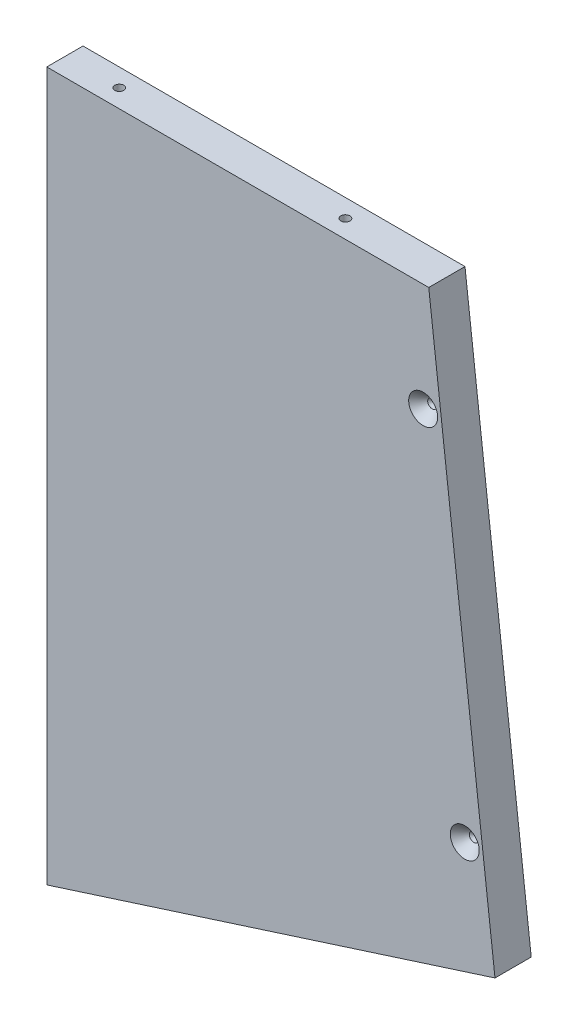
from build123d import *

# Parameters (mm, degrees)
BOSS_EXTRUDE1_DEPTH = 12.7
HOLE3_D             = 3.175
HOLE3_DEPTH         = 31.75
HOLE3_CSINK_D       = 10.16
HOLE3_CSINK_ANGLE   = 82
HOLE3_TIP           = 0.953866233
HOLE6_AT_2_COUNT    = 2
HOLE6_AT_2_PITCH    = 125.108514383
HOLE7_D             = 3.175
HOLE7_DEPTH         = 31.75
HOLE7_CSINK_D       = 10.16
HOLE7_CSINK_ANGLE   = 82
HOLE7_TIP           = 0.953866233
HOLE8_D             = 3.175
HOLE8_DEPTH         = 31.75
HOLE8_CSINK_D       = 10.16
HOLE8_CSINK_ANGLE   = 82
HOLE8_TIP           = 0.953866233


with BuildPart() as part:
    # Sketch1 → Boss-Extrude1 (new body)
    with BuildSketch(Plane.XY):
        Polygon((-88.190159952, 0), (-222.052967181, 0), (-222.052967181, -248.25), (-64.977416983, -197.966048293), align=None)
    extrude(amount=-BOSS_EXTRUDE1_DEPTH)

    # Hole3
    with Locations(Plane(origin=(-234.752967181, 1090.512770337, -135.816741379), x_dir=(0, 0, -1), z_dir=(-1, 0, 0))):
        with Locations((-129.466741379, 1300.662770337), (-129.466741379, 1128.612770337), (129.198788767, 1128.612770337), (129.198788767, 1300.662770337)):
            CounterSinkHole(HOLE3_D / 2, HOLE3_CSINK_D / 2, depth=HOLE3_DEPTH, counter_sink_angle=HOLE3_CSINK_ANGLE)
            with Locations((0, 0, -(HOLE3_DEPTH + HOLE3_TIP / 2))):  # 118° drill point
                Cone(0, HOLE3_D / 2, HOLE3_TIP, mode=Mode.SUBTRACT)

    # Sketch13 → Hole6 (revolve, cut)
    with BuildSketch(Plane(origin=(-90.146601991, -37.840751583, 0), x_dir=(0, -1, 0), z_dir=(1, 0, 0))):
        Polygon((0, 0), (0, 4.128866233), (1.5875, 3.175), (1.5875, 4.017661662), (5.08, 0), align=None)
    hole6 = revolve(axis=Axis((-90.146601991, -37.840751583, 14.308894879), (0, 0, -1)), mode=Mode.SUBTRACT)

    # Hole6 at 2: Hole6 ×2
    with Locations(*[Vector(0.11645832154603887, -0.9931955796028693, 0) * (i * HOLE6_AT_2_PITCH) for i in range(1, HOLE6_AT_2_COUNT)]):
        add(hole6, mode=Mode.SUBTRACT)

    # Hole7
    with Locations(Plane(origin=(181.039434513, 12.7, -135.816741379), x_dir=(0, 0, -1), z_dir=(0, 1, 0))):
        with Locations((129.198788767, 384.042401694), (-129.466741379, 384.042401694), (-129.466741379, 304.786761906), (-110.416741379, 409.442401694), (-0.133976306, 409.442401694), (110.148788767, 409.442401694), (129.198788767, 304.786761906)):
            CounterSinkHole(HOLE7_D / 2, HOLE7_CSINK_D / 2, depth=HOLE7_DEPTH, counter_sink_angle=HOLE7_CSINK_ANGLE)
            with Locations((0, 0, -(HOLE7_DEPTH + HOLE7_TIP / 2))):  # 118° drill point
                Cone(0, HOLE7_D / 2, HOLE7_TIP, mode=Mode.SUBTRACT)

    # Hole8
    with Locations(Plane(origin=(536.177050645, -18.855816567, -135.816741379), x_dir=(0, 0, 1), z_dir=(0.3048844921716131, -0.9523893355310409, 0))):
        with Locations((-129.257383629, 766.263727577), (129.466741379, 668.242950575), (129.466741379, 766.064256541), (-129.408220012, 668.442537903)):
            CounterSinkHole(HOLE8_D / 2, HOLE8_CSINK_D / 2, depth=HOLE8_DEPTH, counter_sink_angle=HOLE8_CSINK_ANGLE)
            with Locations((0, 0, -(HOLE8_DEPTH + HOLE8_TIP / 2))):  # 118° drill point
                Cone(0, HOLE8_D / 2, HOLE8_TIP, mode=Mode.SUBTRACT)


solid = part.part
